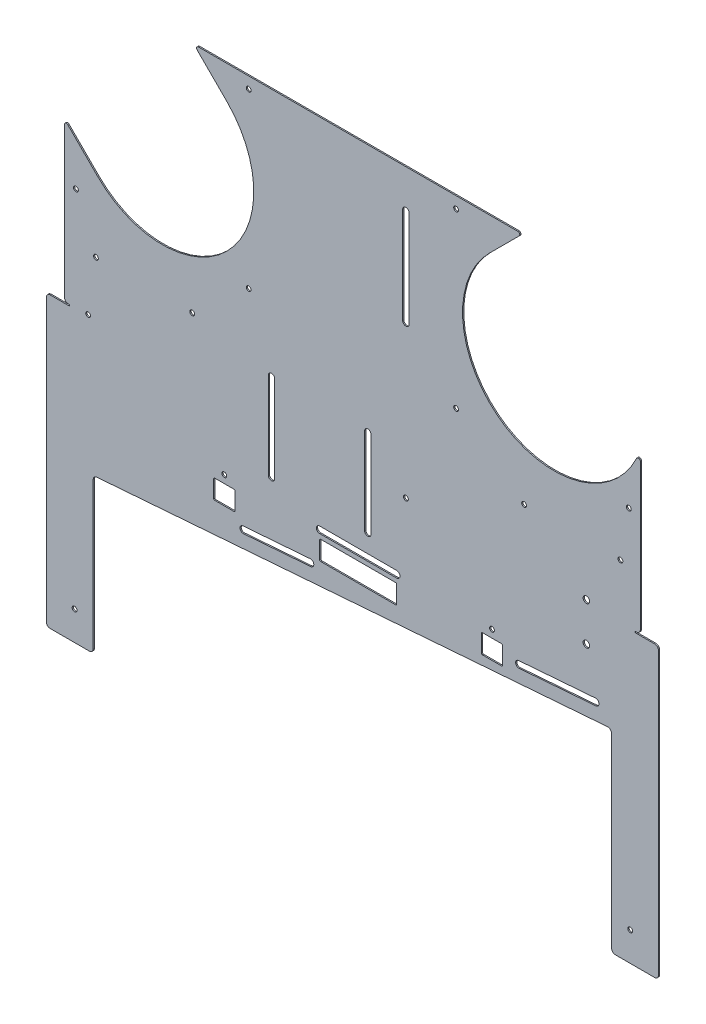
from build123d import *

# Parameters (mm, degrees)
MODEL_R            = 1.25
MODEL_R_2          = 1.7
BASE_FLANGE1_DEPTH = 0.635


# Sheet-metal steps are written as plain solids
with BuildPart() as part:
    # Model → Base-Flange1 (new body)
    with BuildSketch(Plane.XY):
        with BuildLine():
            Line((0, 130.410642225), (0, 52.635))
            ThreePointArc((0, 52.635), (0.585786438, 51.220786438), (2, 50.635))
            Line((2, 50.635), (2.6416, 50.635))
            Line((2.6416, 50.635), (2.6416, 50))
            Line((2.6416, 50), (-7.411304242, 50))
            ThreePointArc((-7.411304242, 50), (-8.825517804, 49.414213562), (-9.411304242, 48))
            Line((-9.411304242, 48), (-9.411304242, -98))
            ThreePointArc((-9.411304242, -98), (-8.825517804, -99.414213562), (-7.411304242, -100))
            Line((-7.411304242, -100), (12.92885, -100))
            ThreePointArc((12.92885, -100), (14.343063562, -99.414213562), (14.92885, -98))
            Line((14.92885, -98), (14.92885, -21.852062278))
            ThreePointArc((14.92885, -21.852062278), (15.461405624, -20.493163091), (16.775457002, -19.857953307))
            Line((16.775457002, -19.857953307), (281.917757002, 0.537608254))
            ThreePointArc((281.917757002, 0.537608254), (283.430049188, 0.01094366), (284.07115, -1.456500717))
            Line((284.07115, -1.456500717), (284.07115, -98))
            ThreePointArc((284.07115, -98), (284.656936438, -99.414213562), (286.07115, -100))
            Line((286.07115, -100), (306.411304242, -100))
            ThreePointArc((306.411304242, -100), (307.825517804, -99.414213562), (308.411304242, -98))
            Line((308.411304242, -98), (308.411304242, 48))
            ThreePointArc((308.411304242, 48), (307.825517804, 49.414213562), (306.411304242, 50))
            Line((306.411304242, 50), (296.3584, 50))
            Line((296.3584, 50), (296.3584, 50.635))
            Line((296.3584, 50.635), (297, 50.635))
            ThreePointArc((297, 50.635), (298.414213562, 51.220786438), (299, 52.635))
            Line((299, 52.635), (299, 128.371893989))
            ThreePointArc((299, 128.371893989), (298.220121803, 129.347366383), (297.096907217, 128.801339474))
            ThreePointArc((297.096907217, 128.801339474), (226.808500251, 110.393354416), (220.612427894, 182.787572106))
            Line((220.612427894, 182.787572106), (236.117749006, 198.292893219))
            ThreePointArc((236.117749006, 198.292893219), (236.334521757, 199.382683432), (235.410642225, 200))
            Line((235.410642225, 200), (69.589357776, 200))
            ThreePointArc((69.589357776, 200), (68.665478243, 199.382683432), (68.882250994, 198.292893219))
            Line((68.882250994, 198.292893219), (84.387572107, 182.787572107))
            ThreePointArc((84.387572107, 182.787572107), (84.387572107, 115.612427894), (17.212427894, 115.612427894))
            Line((17.212427894, 115.612427894), (1.707106781, 131.117749006))
            ThreePointArc((1.707106781, 131.117749006), (0.617316568, 131.334521758), (0, 130.410642225))
        make_face()
        with Locations((177.3, 51)):
            Circle(MODEL_R, mode=Mode.SUBTRACT)
        with Locations((12.3, 51)):
            Circle(MODEL_R, mode=Mode.SUBTRACT)
        with Locations((271, 32.2)):
            Circle(MODEL_R_2, mode=Mode.SUBTRACT)
        with Locations((271, 52.2)):
            Circle(MODEL_R_2, mode=Mode.SUBTRACT)
        with Locations((5.25, -84.9)):
            Circle(MODEL_R, mode=Mode.SUBTRACT)
        with Locations((293.75, -84.9)):
            Circle(MODEL_R, mode=Mode.SUBTRACT)
        with Locations((83, 14.351626942)):
            Circle(MODEL_R, mode=Mode.SUBTRACT)
        with Locations((222, 14.351626942)):
            Circle(MODEL_R, mode=Mode.SUBTRACT)
        with Locations((238.6616, 78.8319)):
            Circle(MODEL_R, mode=Mode.SUBTRACT)
        with Locations((16.3384, 78.8315)):
            Circle(MODEL_R, mode=Mode.SUBTRACT)
        with Locations((203.3563, 104.3563)):
            Circle(MODEL_R, mode=Mode.SUBTRACT)
        with Locations((95.6437, 104.3563)):
            Circle(MODEL_R, mode=Mode.SUBTRACT)
        with Locations((95.6437, 194.0437)):
            Circle(MODEL_R, mode=Mode.SUBTRACT)
        with Locations((5.9563, 104.3563)):
            Circle(MODEL_R, mode=Mode.SUBTRACT)
        with Locations((203.3563, 194.0437)):
            Circle(MODEL_R, mode=Mode.SUBTRACT)
        with Locations((293.0437, 104.3563)):
            Circle(MODEL_R, mode=Mode.SUBTRACT)
        with Locations((66.3384, 78.8315)):
            Circle(MODEL_R, mode=Mode.SUBTRACT)
        with Locations((288.6616, 78.8319)):
            Circle(MODEL_R, mode=Mode.SUBTRACT)
        with BuildLine():
            Line((179, 130), (179, 180))
            ThreePointArc((179, 180), (177.3, 181.7), (175.6, 180))
            Line((175.6, 180), (175.6, 130))
            ThreePointArc((175.6, 130), (177.3, 128.3), (179, 130))
        make_face(mode=Mode.SUBTRACT)
        with BuildLine():
            Line((155.85, 70.582396166), (155.85, 25.582396166))
            ThreePointArc((155.85, 25.582396166), (157.5, 23.932396166), (159.15, 25.582396166))
            Line((159.15, 25.582396166), (159.15, 70.582396166))
            ThreePointArc((159.15, 70.582396166), (157.5, 72.232396166), (155.85, 70.582396166))
        make_face(mode=Mode.SUBTRACT)
        with BuildLine():
            Line((109.15, 25.582396166), (109.15, 70.582396166))
            ThreePointArc((109.15, 70.582396166), (107.5, 72.232396166), (105.85, 70.582396166))
            Line((105.85, 70.582396166), (105.85, 25.582396166))
            ThreePointArc((105.85, 25.582396166), (107.5, 23.932396166), (109.15, 25.582396166))
        make_face(mode=Mode.SUBTRACT)
        with BuildLine():
            Line((172.5, 16.051626942), (132.5, 16.051626942))
            ThreePointArc((132.5, 16.051626942), (130.8, 14.351626942), (132.5, 12.651626942))
            Line((132.5, 12.651626942), (172.5, 12.651626942))
            ThreePointArc((172.5, 12.651626942), (174.2, 14.351626942), (172.5, 16.051626942))
        make_face(mode=Mode.SUBTRACT)
        with BuildLine():
            Line((275.699508159, 10.287481051), (235.81732874, 7.219621092))
            ThreePointArc((235.81732874, 7.219621092), (234.252720163, 5.394244419), (236.078096836, 3.829635842))
            Line((236.078096836, 3.829635842), (275.960276256, 6.8974958))
            ThreePointArc((275.960276256, 6.8974958), (277.524884833, 8.722872474), (275.699508159, 10.287481051))
        make_face(mode=Mode.SUBTRACT)
        with BuildLine():
            Line((77.5, 0.851626942), (77.5, 9.851626942))
            ThreePointArc((77.5, 9.851626942), (77.64644661, 10.205180332), (78, 10.351626942))
            Line((78, 10.351626942), (88, 10.351626942))
            ThreePointArc((88, 10.351626942), (88.353553391, 10.205180332), (88.5, 9.851626942))
            Line((88.5, 9.851626942), (88.5, 0.851626942))
            ThreePointArc((88.5, 0.851626942), (88.353553391, 0.498073551), (88, 0.351626942))
            Line((88, 0.351626942), (78, 0.351626942))
            ThreePointArc((78, 0.351626942), (77.64644661, 0.498073551), (77.5, 0.851626942))
        make_face(mode=Mode.SUBTRACT)
        with BuildLine():
            Line((216.5, 9.851626942), (216.5, 0.851626942))
            ThreePointArc((216.5, 0.851626942), (216.64644661, 0.498073551), (217, 0.351626942))
            Line((217, 0.351626942), (227, 0.351626942))
            ThreePointArc((227, 0.351626942), (227.353553391, 0.498073551), (227.5, 0.851626942))
            Line((227.5, 0.851626942), (227.5, 9.851626942))
            ThreePointArc((227.5, 9.851626942), (227.353553391, 10.205180332), (227, 10.351626942))
            Line((227, 10.351626942), (217, 10.351626942))
            ThreePointArc((217, 10.351626942), (216.64644661, 10.205180332), (216.5, 9.851626942))
        make_face(mode=Mode.SUBTRACT)
        with BuildLine():
            Line((132.5, 9.851626942), (132.5, 0.851626942))
            ThreePointArc((132.5, 0.851626942), (132.64644661, 0.498073551), (133, 0.351626942))
            Line((133, 0.351626942), (172, 0.351626942))
            ThreePointArc((172, 0.351626942), (172.353553391, 0.498073551), (172.5, 0.851626942))
            Line((172.5, 0.851626942), (172.5, 9.851626942))
            ThreePointArc((172.5, 9.851626942), (172.353553391, 10.205180332), (172, 10.351626942))
            Line((172, 10.351626942), (133, 10.351626942))
            ThreePointArc((133, 10.351626942), (132.64644661, 10.205180332), (132.5, 9.851626942))
        make_face(mode=Mode.SUBTRACT)
        with BuildLine():
            Line((127.875303432, -4.493655968), (92.97839644, -7.178033432))
            ThreePointArc((92.97839644, -7.178033432), (91.153019766, -5.613424855), (92.717628343, -3.788048182))
            Line((92.717628343, -3.788048182), (127.614535335, -1.103670718))
            ThreePointArc((127.614535335, -1.103670718), (129.439912009, -2.668279295), (127.875303432, -4.493655968))
        make_face(mode=Mode.SUBTRACT)
    extrude(amount=-BASE_FLANGE1_DEPTH)


solid = part.part
